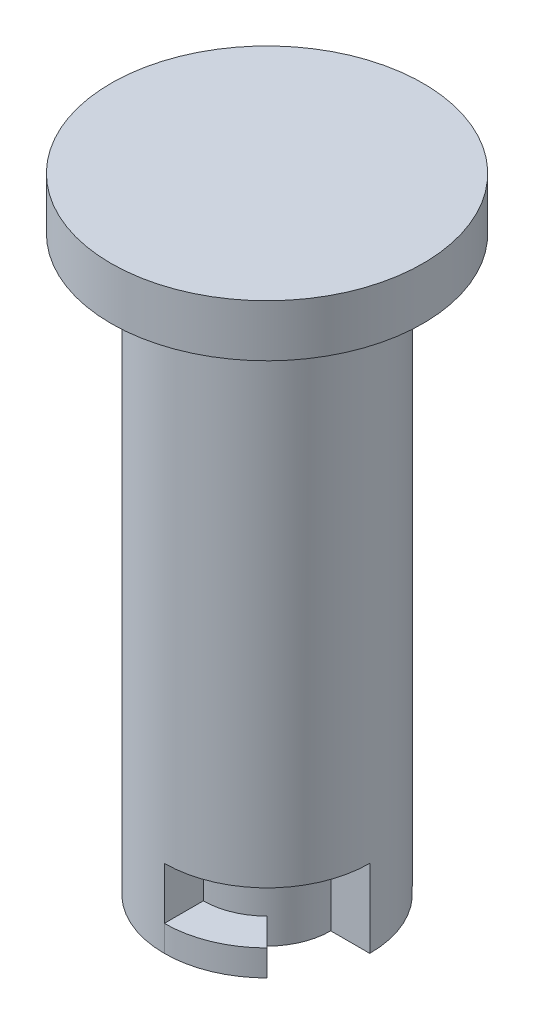
from build123d import *

# Parameters (mm, degrees)
SKETCH1_R           = 3.95
BOSS_EXTRUDE1_DEPTH = 22
SKETCH2_R           = 6
BOSS_EXTRUDE2_DEPTH = 2
CUT_EXTRUDE1_START  = -1
CUT_EXTRUDE1_DEPTH  = 2
CUT_EXTRUDE2_DEPTH  = 3


with BuildPart() as part:
    # Sketch1 → Boss-Extrude1 (new body)
    with BuildSketch(Plane(origin=(0, 0, 0), x_dir=(1, 0, 0), z_dir=(0, 1, 0))):
        Circle(SKETCH1_R)
    extrude(amount=BOSS_EXTRUDE1_DEPTH)

    # Sketch2 → Boss-Extrude2 (add)
    with BuildSketch(Plane(origin=(0, 22, 0), x_dir=(1, 0, 0), z_dir=(0, 1, 0))):
        Circle(SKETCH2_R)
    extrude(amount=BOSS_EXTRUDE2_DEPTH)

    # Sketch3 → Cut-Extrude1 (cut)
    with BuildSketch(Plane.XZ.offset(CUT_EXTRUDE1_START)):
        with BuildLine():
            ThreePointArc((2.793071786, 2.793071786), (1.511599558, 3.649324153), (0, 3.95))
            Line((0, 3.95), (0, 2.45))
            ThreePointArc((0, 2.45), (0.937574409, 2.263504855), (1.732411614, 1.732411614))
            Line((1.732411614, 1.732411614), (2.793071786, 2.793071786))
        make_face()
    extrude(amount=-CUT_EXTRUDE1_DEPTH, mode=Mode.SUBTRACT)

    # Sketch3<3> → Cut-Extrude2 (cut)
    with BuildSketch(Plane.XZ):
        with BuildLine():
            ThreePointArc((3.95, 0), (3.649324153, 1.511599558), (2.793071786, 2.793071786))
            Line((2.793071786, 2.793071786), (1.732411614, 1.732411614))
            ThreePointArc((1.732411614, 1.732411614), (2.263504855, 0.937574409), (2.45, 0))
            Line((2.45, 0), (3.95, 0))
        make_face()
    extrude(amount=-CUT_EXTRUDE2_DEPTH, mode=Mode.SUBTRACT)


solid = part.part
